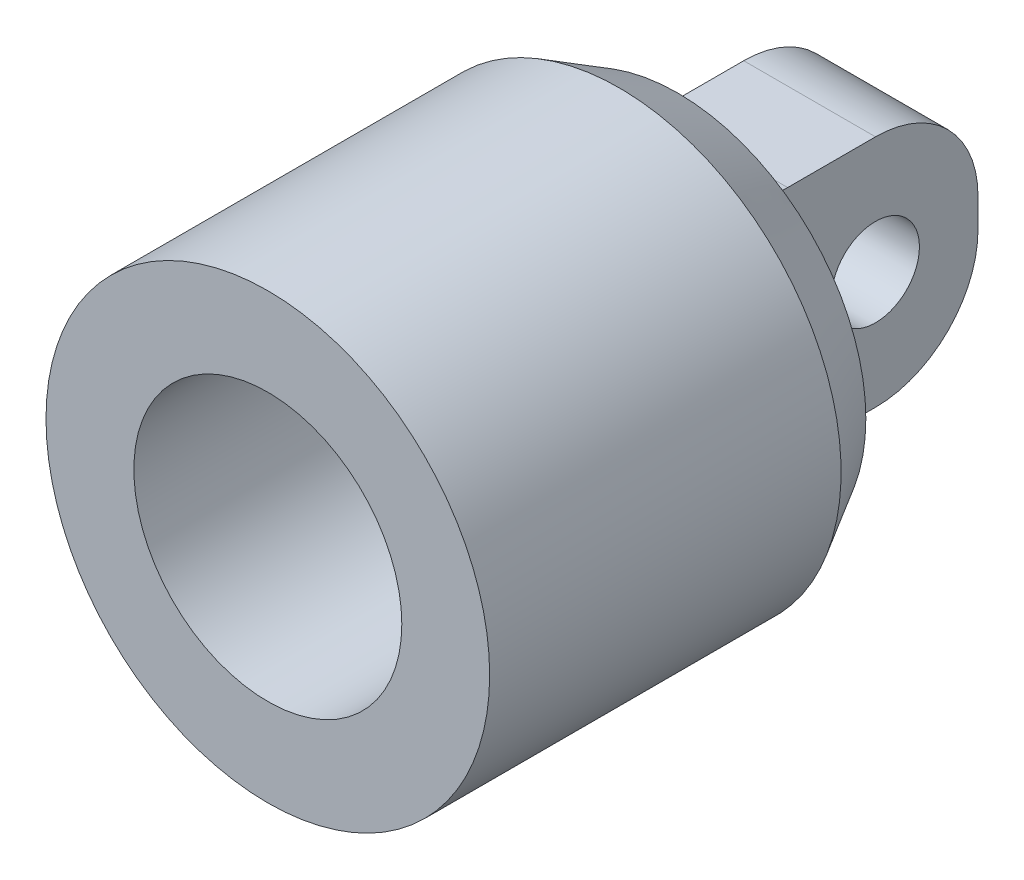
from build123d import *

# Parameters (mm, degrees)
SKETCH1_R           = 7.575
SKETCH1_R_2         = 4.575
BOSS_EXTRUDE1_DEPTH = 12
BOSS_EXTRUDE2_START = 2
SKETCH2_R           = 7.575
BOSS_EXTRUDE2_DEPTH = 2
SKETCH4_W           = 8
SKETCH4_H           = 8
BOSS_EXTRUDE3_DEPTH = 2.25
SKETCH5_R           = 1.5
CUT_EXTRUDE1_DEPTH  = 18.260105735
FILLET1_R           = 3.5
FILLET2_R           = 1.5
FILLET3_R           = 0.8
CHAMFER1_SIZE2      = 2
CHAMFER1_SIZE       = 1.154700538


with BuildPart() as part:
    # Sketch1 → Boss-Extrude1 (new body)
    with BuildSketch(Plane.XY):
        Circle(SKETCH1_R)
        Circle(SKETCH1_R_2, mode=Mode.SUBTRACT)
    extrude(amount=BOSS_EXTRUDE1_DEPTH)

    # Sketch2 → Boss-Extrude2 (add)
    with BuildSketch(Plane(origin=(0, 0, 0), x_dir=(-1, 0, 0), z_dir=(0, 0, -1)).offset(BOSS_EXTRUDE2_START)):
        Circle(SKETCH2_R)
    extrude(amount=-BOSS_EXTRUDE2_DEPTH)

    # Sketch4 → Boss-Extrude3 (add, symmetric)
    with BuildSketch(Plane(origin=(0, 0, 0), x_dir=(0, 0, -1), z_dir=(1, 0, 0))):
        with Locations((6, 0)):
            Rectangle(SKETCH4_W, SKETCH4_H)
    extrude(amount=BOSS_EXTRUDE3_DEPTH, both=True)

    # Sketch5 → Cut-Extrude1 (cut, through all)
    with BuildSketch(Plane(origin=(2.25, 0, 0), x_dir=(0, 0, -1), z_dir=(1, 0, 0))):
        with Locations((6.5, 0)):
            Circle(SKETCH5_R)
    extrude(amount=-CUT_EXTRUDE1_DEPTH, mode=Mode.SUBTRACT)

    # Fillet1
    fillet1_edges = [part.edges().sort_by_distance(p)[0] for p in [
        (0, -4, -10),
        (0, 4, -10),
    ]]
    fillet(fillet1_edges, radius=FILLET1_R)

    # Fillet2
    fillet2_edges = [part.edges().sort_by_distance(p)[0] for p in [
        (0, 4, -2),
        (0, -4, -2),
    ]]
    fillet(fillet2_edges, radius=FILLET2_R)

    # Fillet3
    fillet3_edges = [part.edges().sort_by_distance(p)[0] for p in [
        (-2.25, 0, -2),
        (2.25, 0, -2),
    ]]
    fillet(fillet3_edges, radius=FILLET3_R)

    # Chamfer1
    chamfer1_edges = [part.edges().sort_by_distance(p)[0] for p in [
        (7.575, 0, -2),
    ]]
    chamfer1_side = [part.faces().sort_by_distance(p)[0] for p in [
        (7.551905989, 0, -2),
    ]]
    chamfer(chamfer1_edges, length=CHAMFER1_SIZE - 0.0001, length2=CHAMFER1_SIZE2 - 0.0001, reference=chamfer1_side[0])  # a hair under: the kernel refuses the full size


solid = part.part
